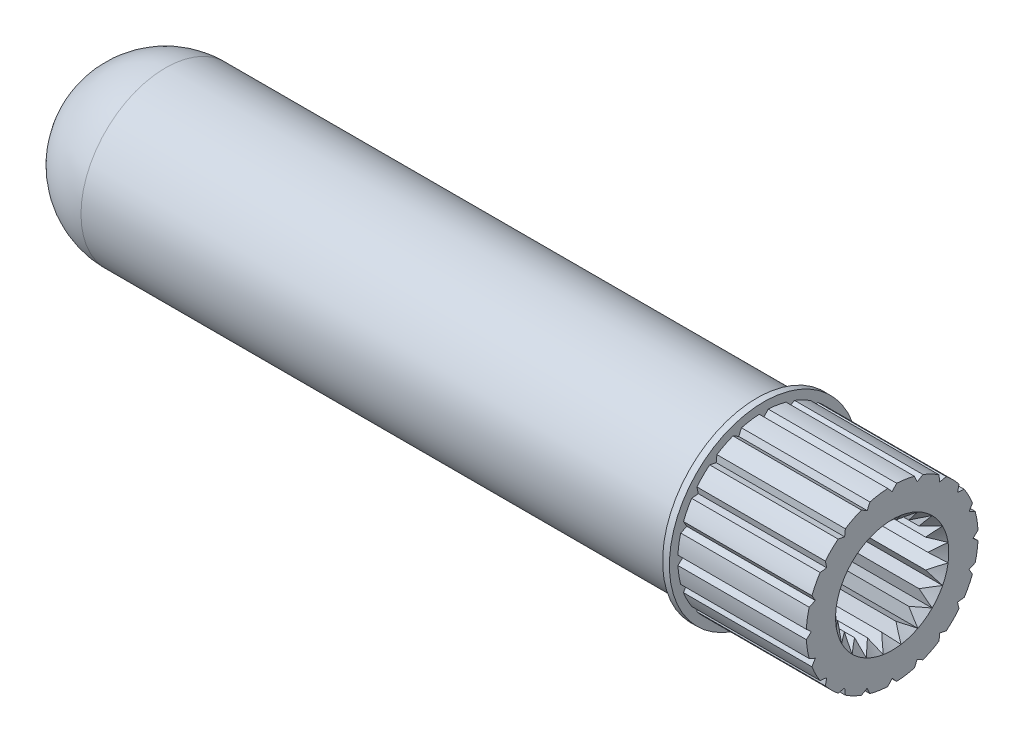
from build123d import *

# Parameters (mm, degrees)
BOSS_EXTRUDE1_DEPTH        = 5.325
BOSS_EXTRUDE1_DEPTH_BACK   = 15.3125
SKETCH1_W                  = 20
SKETCH1_H                  = 20
SKETCH3_R                  = 7.575
CUT_EXTRUDE1_DEPTH         = 4.3
SKETCH4_R                  = 7
CUT_EXTRUDE2_DEPTH         = 12
SKETCH5_R                  = 3.45
CUT_EXTRUDE3_DEPTH         = 15.2
CUT_EXTRUDE4_START         = -15.2
SKETCH6_W                  = 20
SKETCH6_H                  = 20
CUT_EXTRUDE4_DEPTH         = 10.818121557
SKETCH10_W                 = 2.8
SKETCH10_H                 = 2
CUT_EXTRUDE9_DEPTH         = 3
CUT_EXTRUDE11_DEPTH        = 4.3
CUT_EXTRUDE12_DEPTH        = 3.2
FILLET1_R                  = 10
CHAMFER5_SIZE              = 1
SKETCH18_OUTSIDE_W         = 28.422
SKETCH18_OUTSIDE_H         = 23.622
SKETCH18_OUTSIDE_R         = 10
CUT_EXTRUDE14_DEPTH        = 5
SKETCH19_OUTSIDE_W         = 45.742
SKETCH19_OUTSIDE_H         = 40.942
SKETCH19_OUTSIDE_R         = 10
CUT_EXTRUDE15_DEPTH        = 5
CUT_EXTRUDE15_DRAFT        = -60
SKETCH8_R                  = 3.35
START_SIDE_CONNECTOR_DEPTH = 1.8
BOSS_EXTRUDE2_START        = 8
SKETCH9_R                  = 5.085
SKETCH9_R_2                = 3.35
BOSS_EXTRUDE2_DEPTH        = 8
BOSS_EXTRUDE10_DEPTH       = 0.4
BOSS_EXTRUDE10_DEPTH_BACK  = 1
SKETCH40_R                 = 5.585
SKETCH40_R_2               = 5.085
BOSS_EXTRUDE4_DEPTH        = 9.8
CUT_EXTRUDE13_DEPTH        = 7.6
CIRPATTERN1_COUNT          = 20
SKETCH43_R                 = 20
CUT_EXTRUDE29_DEPTH        = 25.444132732
SKETCH44_R                 = 5
BOSS_EXTRUDE11_DEPTH       = 40
FILLET4_R                  = 5


with BuildPart() as part:
    # Sketch1 → Boss-Extrude1 (new, two sides: drawn at the far end of the back side and taken through both)
    with BuildSketch(Plane(origin=(0, 0, 0), x_dir=(1, 0, 0), z_dir=(0, 1, 0)).offset(-BOSS_EXTRUDE1_DEPTH_BACK)):
        Rectangle(SKETCH1_W, SKETCH1_H)
    extrude(amount=BOSS_EXTRUDE1_DEPTH + BOSS_EXTRUDE1_DEPTH_BACK)

    # Sketch3 → Cut-Extrude1 (cut)
    with BuildSketch(Plane(origin=(0, 5.325, 0), x_dir=(1, 0, 0), z_dir=(0, 1, 0))):
        with Locations(Location((0, 0, 0), (0, 0, 270))):
            Circle(SKETCH3_R)
    extrude(amount=-CUT_EXTRUDE1_DEPTH, mode=Mode.SUBTRACT)

    # Sketch4 → Cut-Extrude2 (cut)
    with BuildSketch(Plane(origin=(0, 5.325, 0), x_dir=(1, 0, 0), z_dir=(0, 1, 0))):
        with Locations(Location((0, 0, 0), (0, 0, 270))):
            Circle(SKETCH4_R)
    extrude(amount=-CUT_EXTRUDE2_DEPTH, mode=Mode.SUBTRACT)

    # Sketch5 → Cut-Extrude3 (cut)
    with BuildSketch(Plane(origin=(0, 5.325, 0), x_dir=(1, 0, 0), z_dir=(0, 1, 0))):
        with Locations(Location((0, 0, 0), (0, 0, 270))):
            Circle(SKETCH5_R)
    extrude(amount=-CUT_EXTRUDE3_DEPTH, mode=Mode.SUBTRACT)

    # Sketch6 → Cut-Extrude4 (cut, through all)
    with BuildSketch(Plane(origin=(0, 5.325, 0), x_dir=(1, 0, 0), z_dir=(0, 1, 0)).offset(CUT_EXTRUDE4_START)):
        Rectangle(SKETCH6_W, SKETCH6_H)
    extrude(amount=-CUT_EXTRUDE4_DEPTH, mode=Mode.SUBTRACT)

    # Sketch10 → Cut-Extrude9 (cut)
    with BuildSketch(Plane.XZ.offset(9.875)):
        with Locations((0, -8)):
            Rectangle(SKETCH10_W, SKETCH10_H)
    extrude(amount=-CUT_EXTRUDE9_DEPTH, mode=Mode.SUBTRACT)

    # Sketch15 → Cut-Extrude11 (cut)
    with BuildSketch(Plane(origin=(0, 5.325, 0), x_dir=(1, 0, 0), z_dir=(0, 1, 0))):
        Polygon((-6.865281487, 3.201333333), (-7.725, 1.357661031), (-7.725, -1.357661031), (-6.865281487, -3.201333333), align=None)
    extrude(amount=-CUT_EXTRUDE11_DEPTH, mode=Mode.SUBTRACT)

    # Sketch16 → Cut-Extrude12 (cut)
    with BuildSketch(Plane(origin=(0, -6.675, 0), x_dir=(1, 0, 0), z_dir=(0, 1, 0))):
        Polygon((-3.126761865, 1.458033003), (-3.6, 0.443170548), (-3.6, -0.443170548), (-3.126761865, -1.458033003), align=None)
    extrude(amount=-CUT_EXTRUDE12_DEPTH, mode=Mode.SUBTRACT)

    # Fillet1
    fillet1_edges = [part.edges().sort_by_distance(p)[0] for p in [
        (-10, -2.275, -10),
        (-10, -2.275, 10),
    ]]
    fillet(fillet1_edges, radius=FILLET1_R - 0.0001)  # a hair under: the kernel refuses the full size

    # Chamfer5
    chamfer5_edges = [part.edges().sort_by_distance(p)[0] for p in [
        (4.99995, 5.325, 10),
        (-7.071097101, 5.325, 7.071097101),
        (-7.071097101, 5.325, -7.071097101),
        (4.99995, 5.325, -10),
    ]]
    chamfer(chamfer5_edges, length=CHAMFER5_SIZE)

    # Sketch18 outside → Cut-Extrude14 (cut)
    with BuildSketch(Plane(origin=(10, 0, 0), x_dir=(0, 0, -1), z_dir=(1, 0, 0))):
        with Locations((0, -2.275)):
            Rectangle(SKETCH18_OUTSIDE_W, SKETCH18_OUTSIDE_H)
        Circle(SKETCH18_OUTSIDE_R, mode=Mode.SUBTRACT)
    extrude(amount=-CUT_EXTRUDE14_DEPTH, mode=Mode.SUBTRACT)


with BuildPart() as cut_extrude15_tool:
    # Sketch19 outside → Cut-Extrude15 (with draft: the straight prism first)
    with BuildSketch(Plane(origin=(5, 0, 0), x_dir=(0, 0, -1), z_dir=(1, 0, 0))):
        with Locations((0, -2.275)):
            Rectangle(SKETCH19_OUTSIDE_W, SKETCH19_OUTSIDE_H)
        Circle(SKETCH19_OUTSIDE_R, mode=Mode.SUBTRACT)
    extrude(amount=-CUT_EXTRUDE15_DEPTH)
    # Cut-Extrude15: the draft: its side faces are tilted about the plane it starts from
    cut_extrude15_sides = [cut_extrude15_tool.faces().sort_by_distance(p)[0] for p in [
        (2.5, -22.746, 0),
        (2.5, -2.275, -22.871),
        (2.5, 18.196, 0),
        (2.5, -2.275, 22.871),
        (2.5, 0, 10),
    ]]
    draft(cut_extrude15_sides, Plane(origin=(5, 0, 0), x_dir=(0, 0, -1), z_dir=(1, 0, 0)), CUT_EXTRUDE15_DRAFT)


with BuildPart() as part_1:
    add(part.part)

    # Cut-Extrude15: cut by cut_extrude15_tool
    add(cut_extrude15_tool.part, mode=Mode.SUBTRACT)

    # Sketch8 → Start side connector (cut)
    with BuildSketch(Plane(origin=(10, 0, 0), x_dir=(0, 0, -1), z_dir=(1, 0, 0))):
        Circle(SKETCH8_R)
    extrude(amount=-START_SIDE_CONNECTOR_DEPTH, mode=Mode.SUBTRACT)

    # Sketch9 → Boss-Extrude2 (add)
    with BuildSketch(Plane(origin=(10, 0, 0), x_dir=(0, 0, -1), z_dir=(1, 0, 0)).offset(BOSS_EXTRUDE2_START)):
        Circle(SKETCH9_R)
        Circle(SKETCH9_R_2, mode=Mode.SUBTRACT)
    extrude(amount=-BOSS_EXTRUDE2_DEPTH)

    # Sketch40 → Boss-Extrude10 (add, two sides: drawn at the far end of the back side and taken through both)
    with BuildSketch(Plane(origin=(10, 0, 0), x_dir=(0, 0, -1), z_dir=(1, 0, 0)).offset(-BOSS_EXTRUDE10_DEPTH_BACK)):
        Circle(SKETCH40_R)
        Circle(SKETCH40_R_2, mode=Mode.SUBTRACT)
    extrude(amount=BOSS_EXTRUDE10_DEPTH + BOSS_EXTRUDE10_DEPTH_BACK)

    # Sketch12 → Boss-Extrude4 (add)
    with BuildSketch(Plane(origin=(18, 0, 0), x_dir=(0, 0, -1), z_dir=(1, 0, 0))):
        with BuildLine():
            Line((-0.524055458, -3.308755941), (0, -2.73))
            Line((0, -2.73), (0.524055458, -3.308755941))
            ThreePointArc((0.524055458, -3.308755941), (0, -3.35), (-0.524055458, -3.308755941))
        make_face()
    boss_extrude4 = extrude(amount=-BOSS_EXTRUDE4_DEPTH)

    # Sketch17 → Cut-Extrude13 (cut)
    with BuildSketch(Plane(origin=(18, 0, 0), x_dir=(0, 0, -1), z_dir=(1, 0, 0))):
        with BuildLine():
            Line((-0.265371526, -5.07807079), (0, -4.785))
            Line((0, -4.785), (0.265371526, -5.07807079))
            ThreePointArc((0.265371526, -5.07807079), (0, -5.085), (-0.265371526, -5.07807079))
        make_face()
    cut_extrude13 = extrude(amount=-CUT_EXTRUDE13_DEPTH, mode=Mode.SUBTRACT)

    # CirPattern1: Boss-Extrude4, Cut-Extrude13 ×20 about axis
    cirpattern1_axis = Axis((0, 0, 0), (1, 0, 0))
    add([boss_extrude4.rotate(cirpattern1_axis, i * 360 / CIRPATTERN1_COUNT) for i in range(1, CIRPATTERN1_COUNT)])
    add([cut_extrude13.rotate(cirpattern1_axis, i * 360 / CIRPATTERN1_COUNT) for i in range(1, CIRPATTERN1_COUNT)], mode=Mode.SUBTRACT)

    # Sketch14 → Cut-Revolve1 (revolve, cut)
    with BuildSketch(Plane(origin=(0, 0, 0), x_dir=(1, 0, 0), z_dir=(0, 1, 0))):
        Polygon((18, 2.35), (18, 3.35), (17, 2.35), align=None)
    revolve(axis=Axis((0, 0, 0), (1, 0, 0)), mode=Mode.SUBTRACT)

    # Sketch43 → Cut-Extrude29 (cut, through all)
    with BuildSketch(Plane(origin=(10, 0, 0), x_dir=(0, 0, -1), z_dir=(1, 0, 0))):
        Circle(SKETCH43_R)
    extrude(amount=-CUT_EXTRUDE29_DEPTH, mode=Mode.SUBTRACT)

    # Sketch44 → Boss-Extrude11 (add)
    with BuildSketch(Plane.ZY.offset(-10)):
        with Locations(Location((0, 0, 0), (0, 0, 180))):
            Circle(SKETCH44_R)
    extrude(amount=BOSS_EXTRUDE11_DEPTH)

    # Fillet4
    fillet4_edges = [part_1.edges().sort_by_distance(p)[0] for p in [
        (-30, 0, 5),
    ]]
    fillet(fillet4_edges, radius=FILLET4_R)


solid = part_1.part
